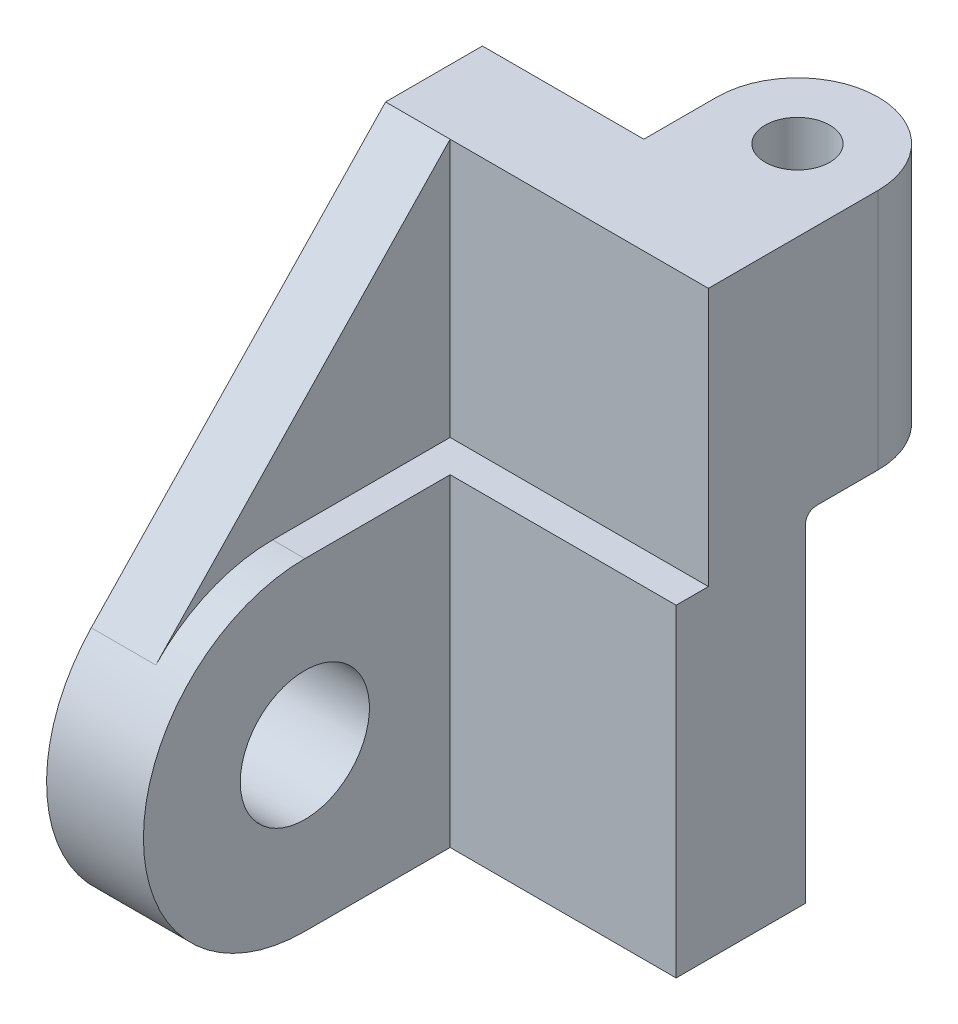
from build123d import *

# Parameters (mm, degrees)
BOSS_EXTRUDE1_DEPTH = 63.5
SKETCH1_3_R         = 12.7
BOSS_EXTRUDE2_DEPTH = 19.05
BOSS_EXTRUDE3_DEPTH = 12.7
SKETCH2_W           = 31.75
SKETCH2_H           = 47.625
BOSS_EXTRUDE4_DEPTH = 31.75
SKETCH3_R           = 6.35
CUT_EXTRUDE1_DEPTH  = 157.350617604
FILLET1_SIZE        = 2.54


with BuildPart() as part:
    # Sketch1 → Boss-Extrude1 (new body)
    with BuildSketch(Plane(origin=(0, 0, 0), x_dir=(0, 0, -1), z_dir=(1, 0, 0))):
        Polygon((0, 0), (0, 114.3), (-19.05, 114.3), (-19.05, 63.5), (-25.4, 63.5), (-25.4, 0), align=None)
    extrude(amount=BOSS_EXTRUDE1_DEPTH)

    # Sketch1<3> → Boss-Extrude2 (add)
    with BuildSketch(Plane(origin=(0, 0, 0), x_dir=(0, 0, -1), z_dir=(1, 0, 0))):
        with BuildLine():
            Line((-53.975, 63.5), (-25.4, 63.5))
            Line((-25.4, 63.5), (-25.4, 0))
            Line((-25.4, 0), (-53.975, 0))
            ThreePointArc((-53.975, 0), (-85.725, 31.75), (-53.975, 63.5))
        make_face()
        with Locations(Location((-53.975, 31.75, 0), (0, 0, 180))):
            Circle(SKETCH1_3_R, mode=Mode.SUBTRACT)
    extrude(amount=BOSS_EXTRUDE2_DEPTH)

    # Sketch1<4> → Boss-Extrude3 (add)
    with BuildSketch(Plane(origin=(0, 0, 0), x_dir=(0, 0, -1), z_dir=(1, 0, 0))):
        with BuildLine():
            Line((-53.975, 63.5), (-25.4, 63.5))
            Line((-25.4, 63.5), (-19.05, 63.5))
            Line((-19.05, 63.5), (-19.05, 114.3))
            Line((-19.05, 114.3), (-76.937767089, 53.676555307))
            ThreePointArc((-76.937767089, 53.676555307), (-66.462881506, 60.941014294), (-53.975, 63.5))
        make_face()
    extrude(amount=BOSS_EXTRUDE3_DEPTH)

    # Sketch2 → Boss-Extrude4 (add)
    with BuildSketch(Plane(origin=(0, 0, 0), x_dir=(-1, 0, 0), z_dir=(0, 0, -1))):
        with Locations((-47.625, 90.4875)):
            Rectangle(SKETCH2_W, SKETCH2_H)
    extrude(amount=BOSS_EXTRUDE4_DEPTH)

    # Sketch3 → Cut-Extrude1 (cut, through all)
    with BuildSketch(Plane(origin=(0, 114.3, 0), x_dir=(1, 0, 0), z_dir=(0, 1, 0))):
        with BuildLine():
            Line((31.75, 31.75), (31.75, 14.341708261))
            ThreePointArc((31.75, 14.341708261), (47.625, 30.216708261), (63.5, 14.341708261))
            Line((63.5, 14.341708261), (63.5, 31.75))
            Line((63.5, 31.75), (31.75, 31.75))
        make_face()
        with Locations(Location((47.625, 14.341708261, 0), (0, 0, 270))):
            Circle(SKETCH3_R)
    extrude(amount=-CUT_EXTRUDE1_DEPTH, mode=Mode.SUBTRACT)

    # Fillet1
    # a fillet whose section is not a circle: 2.54 mm, written as the material it adds along each edge
    with BuildSketch(Plane(origin=(63.5, 66.675, 0), x_dir=(0, -1, 0), z_dir=(-1, 0, 0))) as fillet1_piece_1:
        with BuildLine():
            Bezier((FILLET1_SIZE, 0), (0, 0), (0, -FILLET1_SIZE), weights=[1, 1, 1])
            Line((0, -FILLET1_SIZE), (0, 0))
            Line((0, 0), (FILLET1_SIZE, 0))
        make_face()
    extrude(amount=31.75)


solid = part.part
